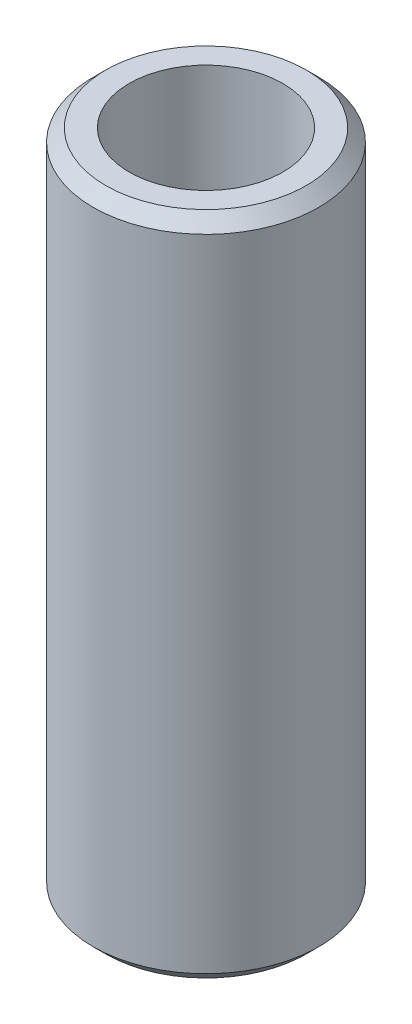
from build123d import *

# Parameters (mm, degrees)
SKETCH1_R           = 52.5
BOSS_EXTRUDE1_DEPTH = 309.801256568
SKETCH2_R           = 35.766078796
CUT_EXTRUDE1_DEPTH  = 319.573882437
CHAMFER1_SIZE       = 5.855480329


with BuildPart() as part:
    # Sketch1 → Boss-Extrude1 (new body)
    with BuildSketch(Plane(origin=(0, 0, 0), x_dir=(1, 0, 0), z_dir=(0, 1, 0))):
        Circle(SKETCH1_R)
    extrude(amount=BOSS_EXTRUDE1_DEPTH)

    # Sketch2 → Cut-Extrude1 (cut, through all)
    with BuildSketch(Plane(origin=(0, 0, 0), x_dir=(1, 0, 0), z_dir=(0, 1, 0))):
        Circle(SKETCH2_R)
    extrude(amount=CUT_EXTRUDE1_DEPTH, mode=Mode.SUBTRACT)

    # Chamfer1
    chamfer1_edges = [part.edges().sort_by_distance(p)[0] for p in [
        (-52.5, 309.801256568, 0),
        (-52.5, 0, 0),
    ]]
    chamfer(chamfer1_edges, length=CHAMFER1_SIZE)


solid = part.part
